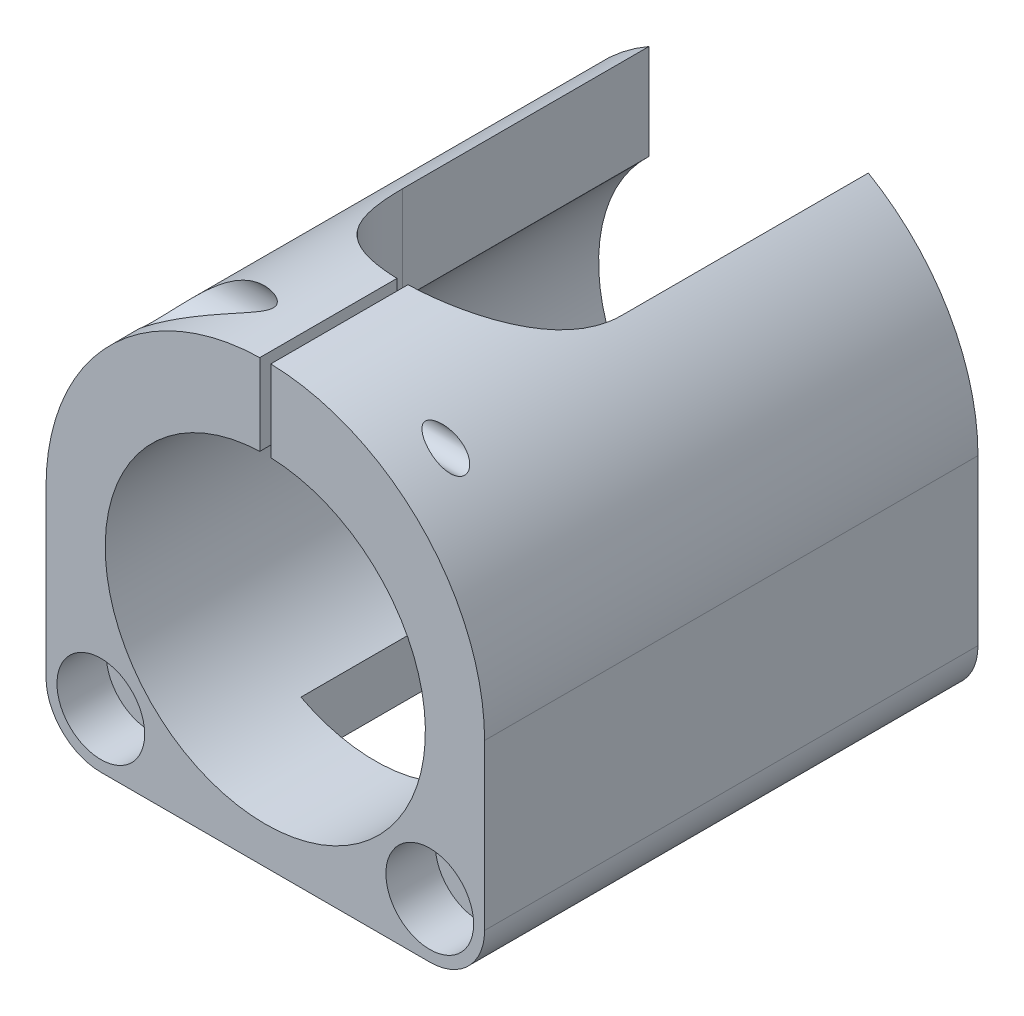
from build123d import *

# Parameters (mm, degrees)
SKETCH_1_W                     = 40
SKETCH_1_H                     = 40
SKETCH_1_R                     = 14.6
EXTRUDE_1_DEPTH                = 45
SKETCH_6_W                     = 1
SKETCH_6_H                     = 22
CUT_EXTRUDE_1_DEPTH            = 54.935146241
M3X0_5_1_D                     = 2.5
HOLE_START                     = -21
HOLE_WIZARD_M3_2_OUTLINE_R     = 3.25
HOLE_WIZARD_M3_2_OUTLINE_R_2   = 1.25
HOLE_WIZARD_M3_2_DEPTH         = 18
HOLE_START_2                   = -3
HOLE_WIZARD_M3_2_2_OUTLINE_R   = 1.7
HOLE_WIZARD_M3_2_2_OUTLINE_R_2 = 1.25
HOLE_WIZARD_M3_2_2_DEPTH       = 2.5
HOLE_WIZARD_M4_1_D             = 4.5
HOLE_WIZARD_M4_1_CBORE_D       = 8
HOLE_WIZARD_M4_1_CBORE_DEPTH   = 4.5
CUT_EXTRUDE_2_REACH            = 65.443
CUT_EXTRUDE_2_END_RADIUS       = 14.6
SKETCH_10_W                    = 13.5
SKETCH_10_H                    = 35
CUT_EXTRUDE_3_DEPTH            = 54.935146365
FILLET_3_DEPTH                 = 45
FILLET_4_R                     = 5


with BuildPart() as part:
    # 草圖1 → 填料-伸長1 (new body)
    with BuildSketch(Plane.XY):
        with Locations((0, 2)):
            Rectangle(SKETCH_1_W, SKETCH_1_H)
        with Locations(Location((0, 0, 0), (0, 0, 180))):
            Circle(SKETCH_1_R, mode=Mode.SUBTRACT)
    extrude(amount=EXTRUDE_1_DEPTH)

    # 草圖6 → 除料-伸長1 (cut, through all)
    with BuildSketch(Plane.XY.offset(45)):
        with Locations((0, 11)):
            Rectangle(SKETCH_6_W, SKETCH_6_H)
    extrude(amount=-CUT_EXTRUDE_1_DEPTH, mode=Mode.SUBTRACT)

    # M3x0.5 螺紋孔1 (through all)
    with Locations(Plane.ZY.offset(20)):
        with Locations((40, 18.295717922)):
            Hole(M3X0_5_1_D / 2)

    # M3 凹頭蓋螺釘的柱孔2: read off the stored shape, not the designer's step
    # M3 凹頭蓋螺釘的柱孔2 outline → M3 凹頭蓋螺釘的柱孔2 (cut)
    with BuildSketch(Plane.YZ.offset(HOLE_START)):
        with Locations((18.295717922, 40)):
            Circle(HOLE_WIZARD_M3_2_OUTLINE_R)
        with Locations((18.295717922, 40)):
            Circle(HOLE_WIZARD_M3_2_OUTLINE_R_2, mode=Mode.SUBTRACT)
    extrude(amount=HOLE_WIZARD_M3_2_DEPTH, mode=Mode.SUBTRACT)

    # Hole Wizard M3 _2 2 outline → Hole Wizard M3 _2 2 (cut)
    with BuildSketch(Plane.YZ.offset(HOLE_START_2)):
        with Locations((18.295717922, 40)):
            Circle(HOLE_WIZARD_M3_2_2_OUTLINE_R)
        with Locations((18.295717922, 40)):
            Circle(HOLE_WIZARD_M3_2_2_OUTLINE_R_2, mode=Mode.SUBTRACT)
    extrude(amount=HOLE_WIZARD_M3_2_2_DEPTH, mode=Mode.SUBTRACT)

    # M4 凹頭蓋螺釘的柱孔1 (through all)
    with Locations(Plane.XY.offset(45)):
        with Locations((15, -13), (-15, -13)):
            CounterBoreHole(HOLE_WIZARD_M4_1_D / 2, HOLE_WIZARD_M4_1_CBORE_D / 2, HOLE_WIZARD_M4_1_CBORE_DEPTH)

    # 除料-伸長2: up to this cylinder (the profile starts outside it)
    cut_extrude_2_end = Plane(origin=(0, 0, 15.25905), z_dir=(0, 0, -1)) * Cylinder(CUT_EXTRUDE_2_END_RADIUS, 161.086, mode=Mode.PRIVATE)
    # 草圖9 → 除料-伸長2 (cut, up to the surface)
    with BuildSketch(Plane.XZ.offset(-22), mode=Mode.PRIVATE) as cut_extrude_2_sk1:
        with BuildLine():
            Line((-10, 0), (10, 0))
            Line((10, 0), (10, 22.5))
            ThreePointArc((10, 22.5), (0, 32.5), (-10, 22.5))
            Line((-10, 22.5), (-10, 0))
        make_face()
    cut_extrude_2_tool1 = extrude(cut_extrude_2_sk1.sketch, amount=CUT_EXTRUDE_2_REACH, mode=Mode.PRIVATE) - cut_extrude_2_end
    add(cut_extrude_2_tool1.solids().sort_by_distance((0, 22, 15.25905))[0], mode=Mode.SUBTRACT)

    # 草圖10 → 除料-伸長3 (cut, through all)
    with BuildSketch(Plane(origin=(0, 0, 0), x_dir=(1, 0, 0), z_dir=(0, 1, 0))):
        with Locations((0, -17.5)):
            Rectangle(SKETCH_10_W, SKETCH_10_H)
    extrude(amount=-CUT_EXTRUDE_3_DEPTH, mode=Mode.SUBTRACT)

    # 圓角3: read off the stored shape, not the designer's step
    # 圓角3 outline → 圓角3 (cut)
    with BuildSketch(Plane.XY):
        with BuildLine():
            Line((20, 2.006250977), (20, 22))
            Line((20, 22), (0.5, 22))
            ThreePointArc((0.5, 22), (14.317821063, 15.970491021), (20, 2.006250977))
        make_face()
        with BuildLine():
            Line((-20, 22), (-20, 2.006250977))
            ThreePointArc((-20, 2.006250977), (-14.317821063, 15.970491021), (-0.5, 22))
            Line((-0.5, 22), (-20, 22))
        make_face()
    extrude(amount=FILLET_3_DEPTH, mode=Mode.SUBTRACT)

    # 圓角4
    fillet_4_edges = [part.edges().sort_by_distance(p)[0] for p in [
        (20, -18, 22.5),
        (-20, -18, 22.5),
    ]]
    fillet(fillet_4_edges, radius=FILLET_4_R)


solid = part.part
